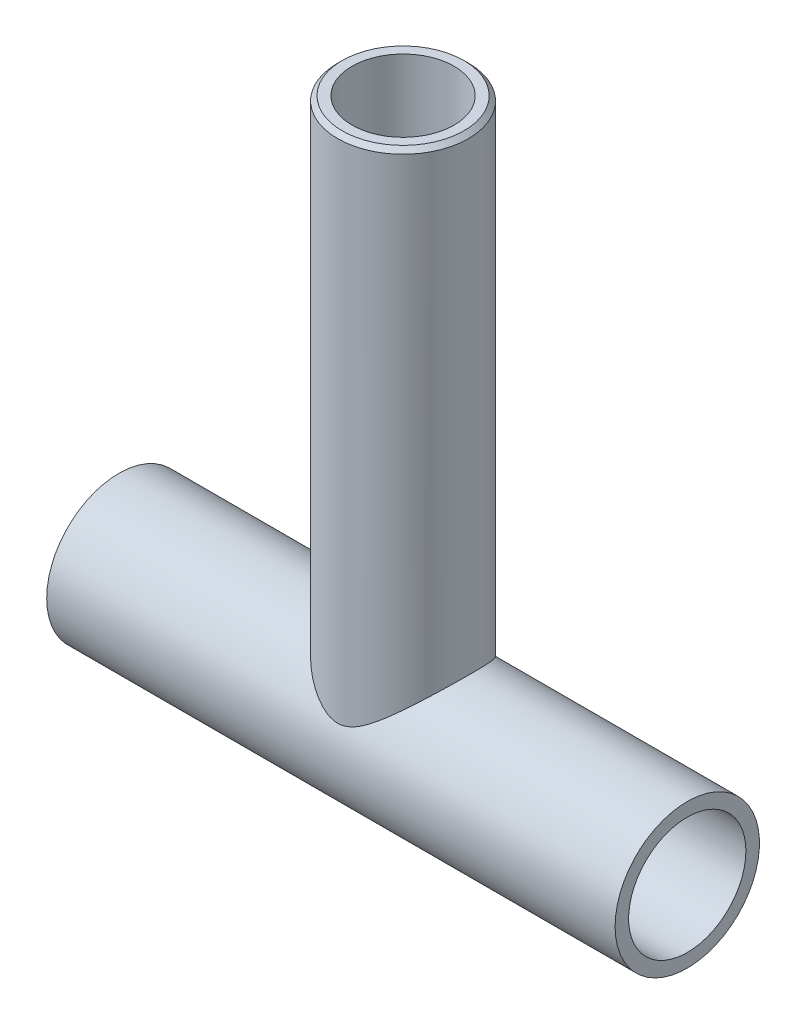
from build123d import *

# Parameters (mm, degrees)
SKETCH1_W                = 126
SKETCH1_H                = 16
M22_CLEARANCE_HOLE1_D    = 26
BOSS_EXTRUDE1_REACH      = 152.735
BOSS_EXTRUDE1_END_RADIUS = 16
SKETCH4_R                = 14.5
CUT_EXTRUDE1_REACH       = 122.529
CUT_EXTRUDE1_END_RADIUS  = 13
SKETCH5_R                = 13
SKETCH6_R                = 9.097381441
CUT_EXTRUDE2_DEPTH       = 0.4
CUT_EXTRUDE2_DRAFT       = -70
SKETCH7_R                = 7.998390473
CUT_EXTRUDE3_DEPTH       = 1.26
CUT_EXTRUDE3_DRAFT       = 50
SKETCH8_R                = 9.5
CUT_EXTRUDE4_DEPTH       = 30.5245
SKETCH9_R                = 11.3155
CUT_EXTRUDE5_DEPTH       = 119.8155
CHAMFER1_SIZE            = 1
FILLET1_R                = 3.2


with BuildPart() as part:
    # Sketch1 → Revolve1 (revolve)
    with BuildSketch(Plane(origin=(0, 0, 0), x_dir=(-1, 0, 0), z_dir=(0, 0, -1)), mode=Mode.PRIVATE) as revolve1_sk:
        with Locations((0, 8)):
            Rectangle(SKETCH1_W, SKETCH1_H)
    revolve(revolve1_sk.sketch.rotate(Axis((63, 0, 0), (-1, 0, 0)), 270), axis=Axis((63, 0, 0), (-1, 0, 0)))

    # M22 Clearance Hole1 (through all)
    with Locations(Plane(origin=(63, 0, 0), x_dir=(0, 0, -1), z_dir=(1, 0, 0))):
        with Locations((0, 0)):
            Hole(M22_CLEARANCE_HOLE1_D / 2)

    # Boss-Extrude1: up to this cylinder (the profile starts outside it)
    boss_extrude1_end = Plane(origin=(0, 0, 0), z_dir=(-1, 0, 0)) * Cylinder(BOSS_EXTRUDE1_END_RADIUS, 338.47, mode=Mode.PRIVATE)
    # Sketch4 → Boss-Extrude1 (add, up to the surface)
    with BuildSketch(Plane(origin=(0, 120, 0), x_dir=(1, 0, 0), z_dir=(0, 1, 0)), mode=Mode.PRIVATE) as boss_extrude1_sk1:
        with Locations(Location((0, 0, 0), (0, 0, 270))):
            Circle(SKETCH4_R)
    boss_extrude1_tool1 = extrude(boss_extrude1_sk1.sketch, amount=-BOSS_EXTRUDE1_REACH, mode=Mode.PRIVATE) - boss_extrude1_end
    add(boss_extrude1_tool1.solids().sort_by_distance((0, 120, 0))[0])

    # Cut-Extrude1: up to this cylinder (the profile starts outside it)
    cut_extrude1_end = Plane(origin=(0, 0, 0), z_dir=(1, 0, 0)) * Cylinder(CUT_EXTRUDE1_END_RADIUS, 272.058, mode=Mode.PRIVATE)
    # Sketch5 → Cut-Extrude1 (cut, up to the surface)
    with BuildSketch(Plane(origin=(0, 18.5, 0), x_dir=(1, 0, 0), z_dir=(0, 1, 0)), mode=Mode.PRIVATE) as cut_extrude1_sk1:
        with Locations(Location((0, 0, 0), (0, 0, 90))):
            Circle(SKETCH5_R)
    cut_extrude1_tool1 = extrude(cut_extrude1_sk1.sketch, amount=-CUT_EXTRUDE1_REACH, mode=Mode.PRIVATE) - cut_extrude1_end
    add(cut_extrude1_tool1.solids().sort_by_distance((0, 18.5, 0))[0], mode=Mode.SUBTRACT)


with BuildPart() as cut_extrude2_tool:
    # Sketch6 → Cut-Extrude2 (with draft: the straight prism first)
    with BuildSketch(Plane.XZ.offset(-18.5)):
        Circle(SKETCH6_R)
    extrude(amount=-CUT_EXTRUDE2_DEPTH)
    # Cut-Extrude2: the draft: its side faces are tilted about the plane it starts from
    cut_extrude2_sides = [cut_extrude2_tool.faces().sort_by_distance(p)[0] for p in [
        (-9.097381441, 18.7, 0),
    ]]
    draft(cut_extrude2_sides, Plane.XZ.offset(-18.5), CUT_EXTRUDE2_DRAFT)


with BuildPart() as part_1:
    add(part.part)

    # Cut-Extrude2: cut by cut_extrude2_tool
    add(cut_extrude2_tool.part, mode=Mode.SUBTRACT)


with BuildPart() as cut_extrude3_tool:
    # Sketch7 → Cut-Extrude3 (with draft: the straight prism first)
    with BuildSketch(Plane.XZ.offset(-18.9)):
        Circle(SKETCH7_R)
    extrude(amount=-CUT_EXTRUDE3_DEPTH)
    # Cut-Extrude3: the draft: its side faces are tilted about the plane it starts from
    cut_extrude3_sides = [cut_extrude3_tool.faces().sort_by_distance(p)[0] for p in [
        (-7.998390473, 19.53, 0),
    ]]
    draft(cut_extrude3_sides, Plane.XZ.offset(-18.9), CUT_EXTRUDE3_DRAFT)


with BuildPart() as part_2:
    add(part_1.part)

    # Cut-Extrude3: cut by cut_extrude3_tool
    add(cut_extrude3_tool.part, mode=Mode.SUBTRACT)

    # Sketch8 → Cut-Extrude4 (cut)
    with BuildSketch(Plane.XZ.offset(-20.16)):
        with Locations(Location((0, 0, 0), (0, 0, 90))):
            Circle(SKETCH8_R)
    extrude(amount=-CUT_EXTRUDE4_DEPTH, mode=Mode.SUBTRACT)

    # Sketch9 → Cut-Extrude5 (cut)
    with BuildSketch(Plane(origin=(0, 120, 0), x_dir=(-1, 0, 0), z_dir=(0, 1, 0))):
        with Locations(Location((0, 0, 0), (0, 0, 270))):
            Circle(SKETCH9_R)
    extrude(amount=-CUT_EXTRUDE5_DEPTH, mode=Mode.SUBTRACT)

    # Chamfer1
    chamfer1_edges = [part_2.edges().sort_by_distance(p)[0] for p in [
        (0, 120, -14.5),
    ]]
    chamfer(chamfer1_edges, length=CHAMFER1_SIZE)

    # Fillet1
    # the kernel refuses this fillet: 3.2 mm, written as the material it adds along each edge
    with BuildSketch(Plane(origin=(0, 18.5, 0), x_dir=(0, 0, -1), z_dir=(1, 0, 0))) as fillet1_piece_1:
        with BuildLine():
            CenterArc((9.8, -2.818378922), FILLET1_R, 0, 61.73217134)
            Line((13, -2.818378922), (13.064, -2.818378922))
            Line((13.064, -2.818378922), (13.064, 0))
            Line((13.064, 0), (13, 0.064))
            ThreePointArc((13, 0.064), (12.15775, 0.064), (11.34581, 0.056367578))
            Line((11.34581, 0.056367578), (11.3155, 0))
        make_face()
    revolve(axis=Axis((0, 18.5, 0), (0, 1, 0)))


solid = part_2.part
